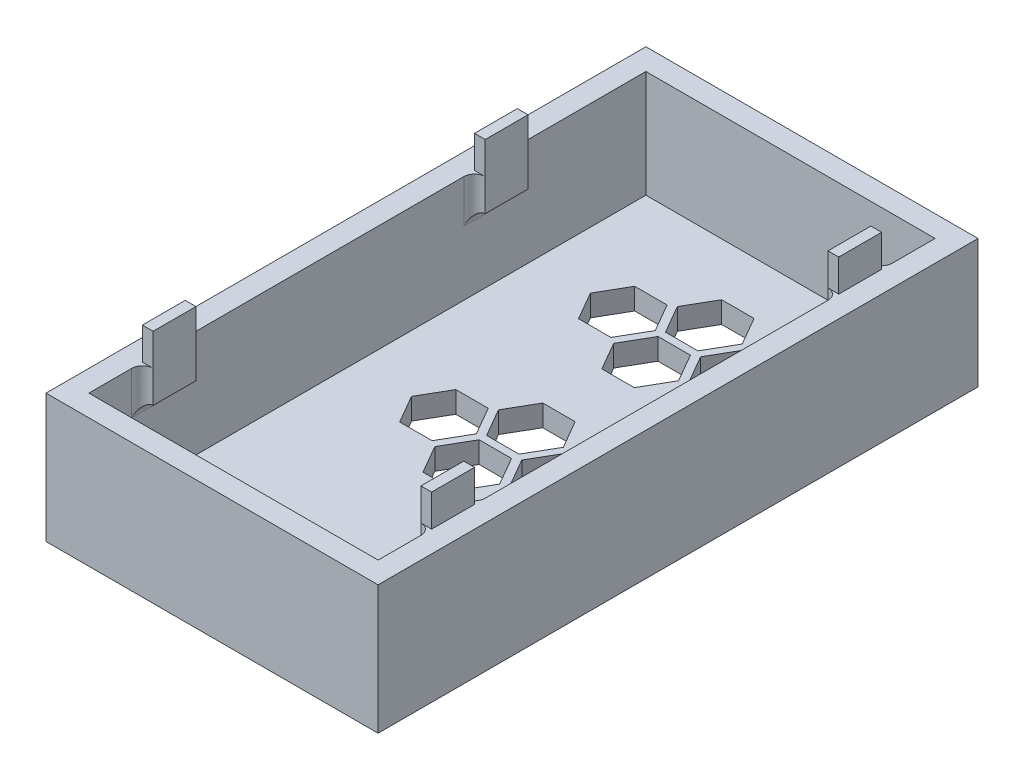
from build123d import *

# Parameters (mm, degrees)
ESQUISSE1_W             = 31
ESQUISSE1_H             = 56
BOSS_EXTRU_1_DEPTH      = 2
ENL_V_MAT_EXTRU_1_DEPTH = 65.039050586
ESQUISSE6_W             = 31
ESQUISSE6_H             = 56
ESQUISSE6_W_2           = 27
ESQUISSE6_H_2           = 52
BOSS_EXTRU_3_DEPTH      = 10
ESQUISSE10_W            = 4
ESQUISSE10_H            = 6
BOSS_EXTRU_8_DEPTH      = 1
CONG_1_R                = 1
ESQUISSE11_W            = 4
ESQUISSE11_H            = 6
BOSS_EXTRU_11_DEPTH     = 1
CONG_2_R                = 1


with BuildPart() as part:
    # Esquisse1 → Boss.-Extru.1 (new body)
    with BuildSketch(Plane(origin=(0, 0, 0), x_dir=(1, 0, 0), z_dir=(0, 1, 0))):
        with Locations((15.5, 28)):
            Rectangle(ESQUISSE1_W, ESQUISSE1_H)
    extrude(amount=BOSS_EXTRU_1_DEPTH)

    # Esquisse2 → Enlèv. mat.-Extru.1 (cut, through all)
    with BuildSketch(Plane(origin=(0, 2, 0), x_dir=(1, 0, 0), z_dir=(0, 1, 0))):
        Polygon((13.380581824, 43.489934015), (11.867381431, 46.110873977), (8.840980645, 46.110873977), (7.327780252, 43.489934015), (8.840980645, 40.868994052), (11.867381431, 40.868994052), align=None)
        Polygon((13.380581824, 26.792968516), (11.867381431, 29.413908479), (8.840980645, 29.413908479), (7.327780252, 26.792968516), (8.840980645, 24.172028553), (11.867381431, 24.172028553), align=None)
        Polygon((18.526400786, 46.460873977), (17.013200393, 49.08181394), (13.986799607, 49.08181394), (12.473599214, 46.460873977), (13.986799607, 43.839934015), (17.013200393, 43.839934015), align=None)
        Polygon((18.526400786, 40.518994052), (17.013200393, 43.139934015), (13.986799607, 43.139934015), (12.473599214, 40.518994052), (13.986799607, 37.898054089), (17.013200393, 37.898054089), align=None)
        Polygon((23.672219675, 43.490211012), (22.158779402, 46.111012465), (19.132378628, 46.110735468), (17.619418128, 43.489657017), (19.132858402, 40.868855564), (22.159259175, 40.869132561), align=None)
        Polygon((18.526400786, 29.763908479), (17.013200393, 32.384848442), (13.986799607, 32.384848442), (12.473599214, 29.763908479), (13.986799607, 27.142968516), (17.013200393, 27.142968516), align=None)
        Polygon((18.526400786, 23.822028553), (17.013200393, 26.442968516), (13.986799607, 26.442968516), (12.473599214, 23.822028553), (13.986799607, 21.20108859), (17.013200393, 21.20108859), align=None)
        Polygon((23.672219675, 26.793245513), (22.158779402, 29.414046967), (19.132378628, 29.413769969), (17.619418128, 26.792691519), (19.132858402, 24.171890065), (22.159259175, 24.172167063), align=None)
    extrude(amount=-ENL_V_MAT_EXTRU_1_DEPTH, mode=Mode.SUBTRACT)

    # Esquisse6 → Boss.-Extru.3 (add)
    with BuildSketch(Plane(origin=(0, 2, 0), x_dir=(1, 0, 0), z_dir=(0, 1, 0))):
        with Locations((15.5, 28)):
            Rectangle(ESQUISSE6_W, ESQUISSE6_H)
        with Locations((15.5, 28)):
            Rectangle(ESQUISSE6_W_2, ESQUISSE6_H_2, mode=Mode.SUBTRACT)
    extrude(amount=BOSS_EXTRU_3_DEPTH)

    # Esquisse10 → Boss.-Extru.8 (add)
    with BuildSketch(Plane.ZY.offset(-29)):
        with Locations((-47, 12)):
            Rectangle(ESQUISSE10_W, ESQUISSE10_H)
        with Locations((-9, 12)):
            Rectangle(ESQUISSE10_W, ESQUISSE10_H)
    extrude(amount=BOSS_EXTRU_8_DEPTH)

    # Congé1
    cong_1_edges = [part.edges().sort_by_distance(p)[0] for p in [
        (29, 9, -9),
        (29, 10.5, -11),
        (29, 10.5, -7),
        (29, 9, -47),
        (29, 10.5, -45),
        (29, 10.5, -49),
    ]]
    fillet(cong_1_edges, radius=CONG_1_R - 0.0001)  # a hair under: the kernel refuses the full size

    # Esquisse11 → Boss.-Extru.11 (add)
    with BuildSketch(Plane(origin=(2, 0, 0), x_dir=(0, 0, -1), z_dir=(1, 0, 0))):
        with Locations((9, 12)):
            Rectangle(ESQUISSE11_W, ESQUISSE11_H)
        with Locations((40, 12)):
            Rectangle(ESQUISSE11_W, ESQUISSE11_H)
    extrude(amount=BOSS_EXTRU_11_DEPTH)

    # Congé2
    cong_2_edges = [part.edges().sort_by_distance(p)[0] for p in [
        (2, 10.5, -7),
        (2, 9, -9),
        (2, 10.5, -11),
        (2, 10.5, -42),
        (2, 9, -40),
        (2, 10.5, -38),
    ]]
    fillet(cong_2_edges, radius=CONG_2_R - 0.0001)  # a hair under: the kernel refuses the full size


solid = part.part
